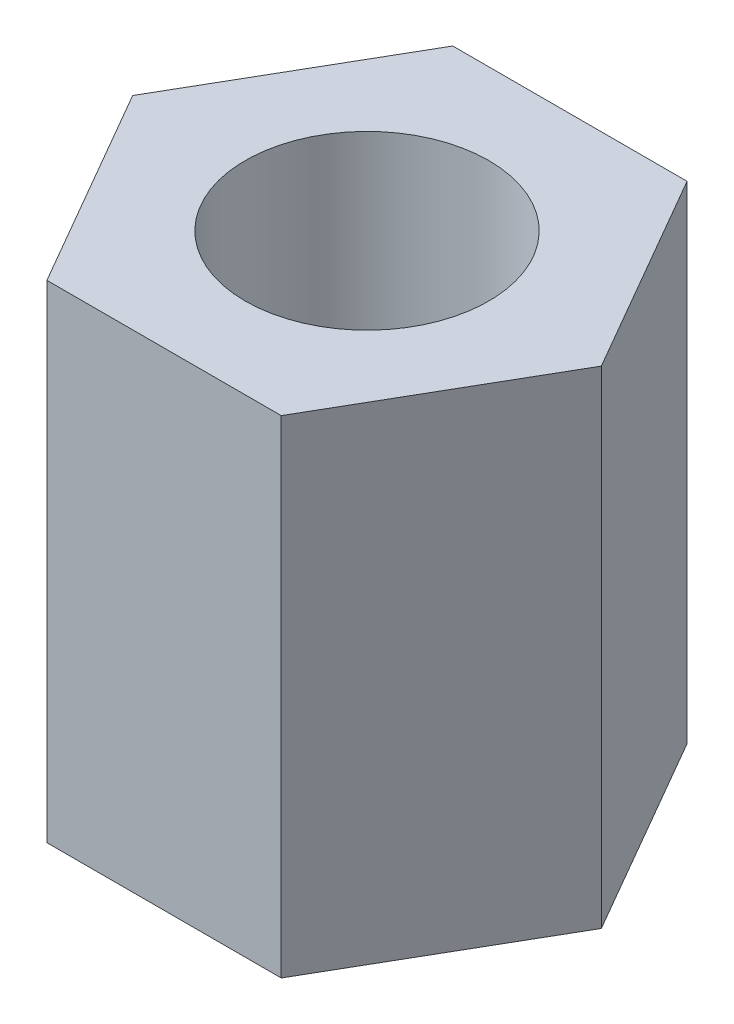
from build123d import *

# Parameters (mm, degrees)
CROQUIS1_R              = 1.5
SALIENTE_EXTRUIR1_DEPTH = 3


with BuildPart() as part:
    # Croquis1 → Saliente-Extruir1 (new, symmetric)
    with BuildSketch(Plane(origin=(0, 0, 0), x_dir=(1, 0, 0), z_dir=(0, 1, 0))):
        Polygon((1.443375673, -2.5), (2.886751346, 0), (1.443375673, 2.5), (-1.443375673, 2.5), (-2.886751346, 0), (-1.443375673, -2.5), align=None)
        Circle(CROQUIS1_R, mode=Mode.SUBTRACT)
    extrude(amount=SALIENTE_EXTRUIR1_DEPTH, both=True)


solid = part.part
